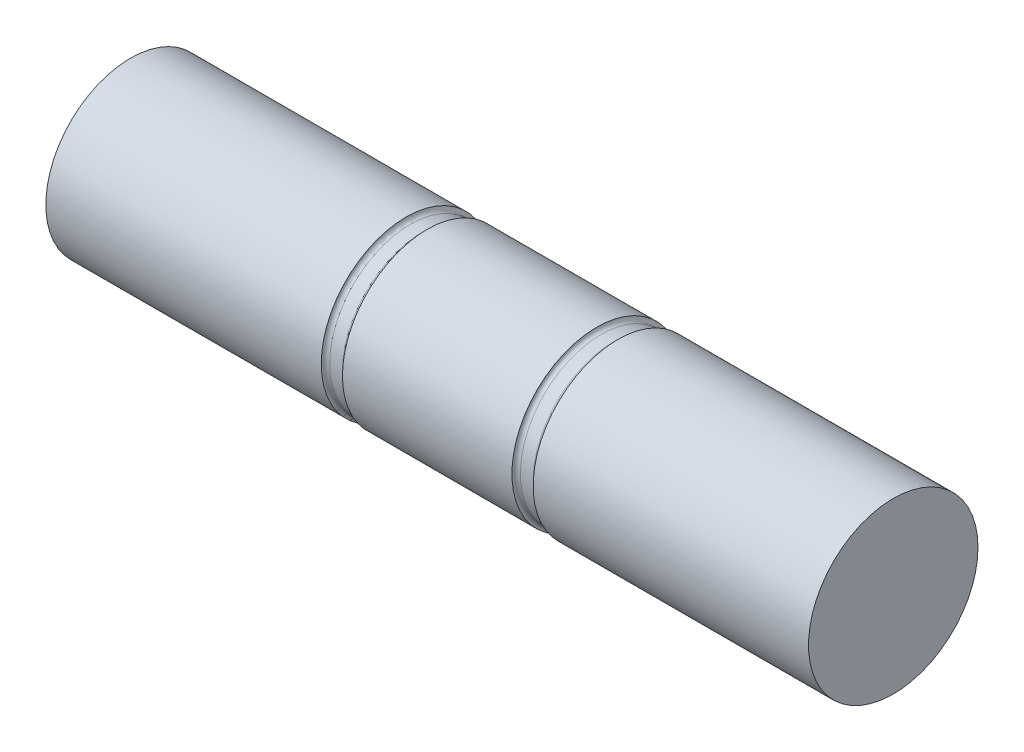
from build123d import *

# Parameters (mm, degrees)
SKETCH_1_R          = 2
EXTRUDE_1_DEPTH     = 18
CUT_EXTRUDE_START   = -7
SKETCH_2_R          = 2
SKETCH_2_R_2        = 1.9
CUT_EXTRUDE_1_DEPTH = 0.5
FILLET_1_R          = 0.1


with BuildPart() as part:
    # 草图1 → 凸台-拉伸1 (new body)
    with BuildSketch(Plane(origin=(0, 0, 0), x_dir=(0, 0, -1), z_dir=(1, 0, 0))):
        Circle(SKETCH_1_R)
    extrude(amount=EXTRUDE_1_DEPTH)

    # 草图2 → 切除-拉伸1 (cut)
    with BuildSketch(Plane(origin=(18, 0, 0), x_dir=(0, 0, -1), z_dir=(1, 0, 0)).offset(CUT_EXTRUDE_START)):
        Circle(SKETCH_2_R)
        Circle(SKETCH_2_R_2, mode=Mode.SUBTRACT)
    cut_extrude_1 = extrude(amount=CUT_EXTRUDE_1_DEPTH, mode=Mode.SUBTRACT)

    # 镜向1: 切除-拉伸1 across plane
    add(cut_extrude_1.mirror(Plane(origin=(9, 0, 0), x_dir=(0, 0, 1), z_dir=(1, 0, 0))), mode=Mode.SUBTRACT)

    # 圆角1
    fillet_1_edges = [part.edges().sort_by_distance(p)[0] for p in [
        (6.5, 0, 1.9),
        (7, 0, 1.9),
        (11, 0, 1.9),
        (11.5, 0, 1.9),
    ]]
    fillet(fillet_1_edges, radius=FILLET_1_R - 0.0001)  # a hair under: the kernel refuses the full size


solid = part.part
